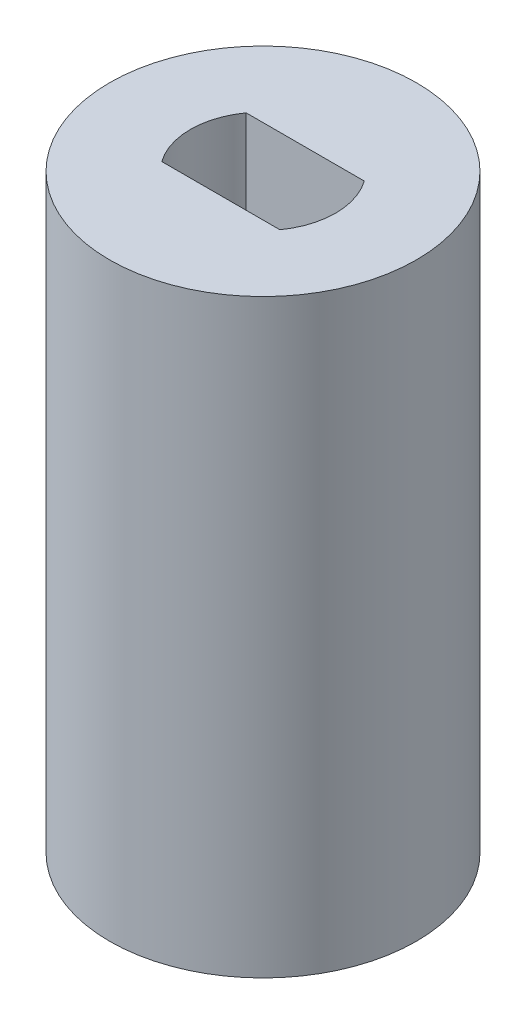
from build123d import *

# Parameters (mm, degrees)
SKETCH1_W          = 4
SKETCH1_H          = 20
CUT_EXTRUDE1_DEPTH = 8


with BuildPart() as part:
    # Sketch1 → Revolve1 (revolve)
    with BuildSketch(Plane.XY):
        with Locations((-3.2, 10)):
            Rectangle(SKETCH1_W, SKETCH1_H)
    revolve(axis=Axis((0, 0, 0), (0, 1, 0)))

    # Sketch3 → Cut-Extrude1 (cut)
    with BuildSketch(Plane(origin=(0, 20, 0), x_dir=(1, 0, 0), z_dir=(0, 1, 0))):
        with BuildLine():
            Line((-2.001674299, 1.43), (2.001674299, 1.43))
            ThreePointArc((2.001674299, 1.43), (2.46, 0), (2.001674299, -1.43))
            Line((2.001674299, -1.43), (-2.001674299, -1.43))
            ThreePointArc((-2.001674299, -1.43), (-2.46, 0), (-2.001674299, 1.43))
        make_face()
    extrude(amount=-CUT_EXTRUDE1_DEPTH, mode=Mode.SUBTRACT)


solid = part.part
